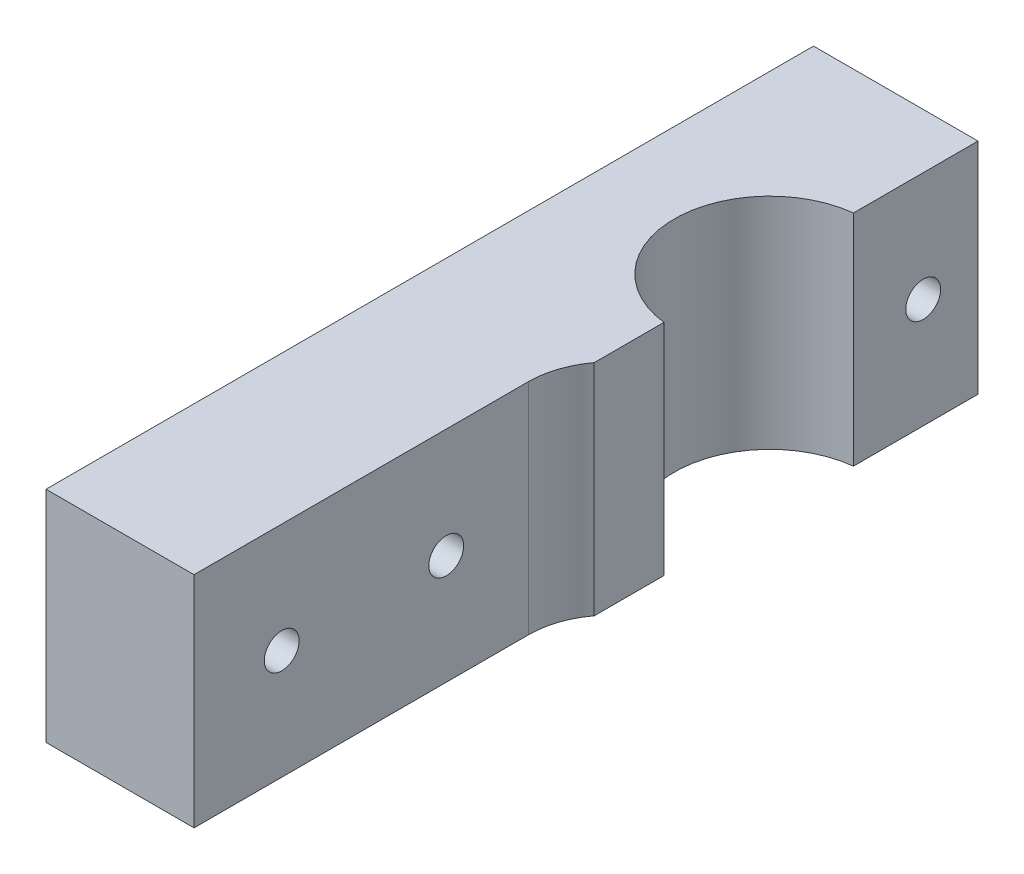
from build123d import *

# Parameters (mm, degrees)
BOSS_EXTRUDE1_DEPTH        = 12.7
SKETCH7_W                  = 1.905
SKETCH7_H                  = 44.45
CUT_EXTRUDE1_DEPTH         = 72.346425278
FILLET1_R                  = 9.525
F_10_32_TAPPED_HOLE1_D     = 4.0386
F_10_32_TAPPED_HOLE1_DEPTH = 14.478
F_10_32_TAPPED_HOLE1_TIP   = 1.213317848
F_10_32_TAPPED_HOLE2_D     = 4.0386
F_10_32_TAPPED_HOLE2_DEPTH = 14.478
F_10_32_TAPPED_HOLE2_TIP   = 1.213317848


with BuildPart() as part:
    # Sketch1 → Boss-Extrude1 (new, symmetric)
    with BuildSketch(Plane(origin=(0, 0, 0), x_dir=(1, 0, 0), z_dir=(0, 1, 0))):
        with BuildLine():
            Line((-1.27, 10.975768811), (-1.27, 25.4))
            Line((-1.27, 25.4), (-20.32, 25.4))
            Line((-20.32, 25.4), (-20.32, -63.5))
            Line((-20.32, -63.5), (-1.27, -63.5))
            Line((-1.27, -63.5), (-1.27, -10.975768811))
            ThreePointArc((-1.27, -10.975768811), (-11.049, 0), (-1.27, 10.975768811))
        make_face()
    extrude(amount=BOSS_EXTRUDE1_DEPTH, both=True)

    # Sketch7 → Cut-Extrude1 (cut, through all)
    with BuildSketch(Plane(origin=(0, 12.7, 0), x_dir=(1, 0, 0), z_dir=(0, 1, 0))):
        with Locations((-2.2225, -41.275)):
            Rectangle(SKETCH7_W, SKETCH7_H)
    extrude(amount=-CUT_EXTRUDE1_DEPTH, mode=Mode.SUBTRACT)

    # Fillet1
    # the kernel refuses this fillet: 9.525 mm, written as the material it adds along each edge
    with BuildSketch(Plane(origin=(-3.175, 12.7, 19.05), x_dir=(1, 0, 0), z_dir=(0, -1, 0))) as fillet1_piece_1:
        with BuildLine():
            CenterArc((9.525, 5.715), FILLET1_R, 180, 36.869897646)
            Line((0, 5.715), (-0.1905, 5.715))
            Line((-0.1905, 5.715), (-0.1905, 0))
            Line((-0.1905, 0), (0, -0.1905))
            ThreePointArc((0, -0.1905), (0.9525, -0.1905), (1.7526, -0.1143))
            Line((1.7526, -0.1143), (1.905, 0))
        make_face()
    extrude(amount=25.4)

    # #10-32 Tapped Hole1
    with Locations(Plane(origin=(-3.175, 0, 0), x_dir=(0, 0, -1), z_dir=(1, 0, 0))):
        with Locations((-53.34, 0), (-34.29, 0)):
            Hole(F_10_32_TAPPED_HOLE1_D / 2, depth=F_10_32_TAPPED_HOLE1_DEPTH)
            with Locations((0, 0, -(F_10_32_TAPPED_HOLE1_DEPTH + F_10_32_TAPPED_HOLE1_TIP / 2))):  # 118° drill point
                Cone(0, F_10_32_TAPPED_HOLE1_D / 2, F_10_32_TAPPED_HOLE1_TIP, mode=Mode.SUBTRACT)

    # #10-32 Tapped Hole2
    with Locations(Plane(origin=(-1.27, 0, 0), x_dir=(0, 0, -1), z_dir=(1, 0, 0))):
        with Locations((19.05, 0)):
            Hole(F_10_32_TAPPED_HOLE2_D / 2, depth=F_10_32_TAPPED_HOLE2_DEPTH)
            with Locations((0, 0, -(F_10_32_TAPPED_HOLE2_DEPTH + F_10_32_TAPPED_HOLE2_TIP / 2))):  # 118° drill point
                Cone(0, F_10_32_TAPPED_HOLE2_D / 2, F_10_32_TAPPED_HOLE2_TIP, mode=Mode.SUBTRACT)


solid = part.part
